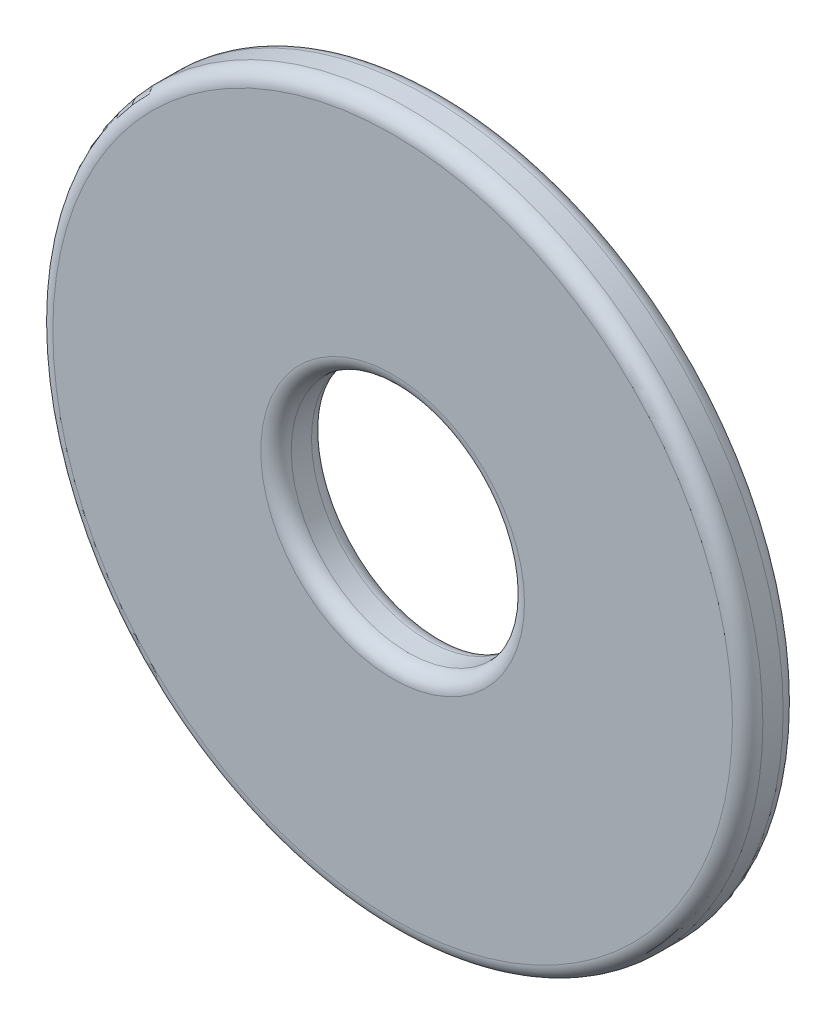
from build123d import *

# Parameters (mm, degrees)
SKETCH1_R      = 3.5
SKETCH1_R_2    = 1.15
EXTRUDE1_DEPTH = 0.25
FILLET1_R      = 0.15


with BuildPart() as part:
    # Sketch1 → Extrude1 (new, symmetric)
    with BuildSketch(Plane.XY):
        Circle(SKETCH1_R)
        Circle(SKETCH1_R_2, mode=Mode.SUBTRACT)
    extrude(amount=EXTRUDE1_DEPTH, both=True)

    # Fillet1
    fillet1_edges = [part.edges().sort_by_distance(p)[0] for p in [
        (-1.15, 0, -0.25),
        (-1.15, 0, 0.25),
        (-3.5, 0, -0.25),
        (-3.5, 0, 0.25),
    ]]
    fillet(fillet1_edges, radius=FILLET1_R)


solid = part.part
